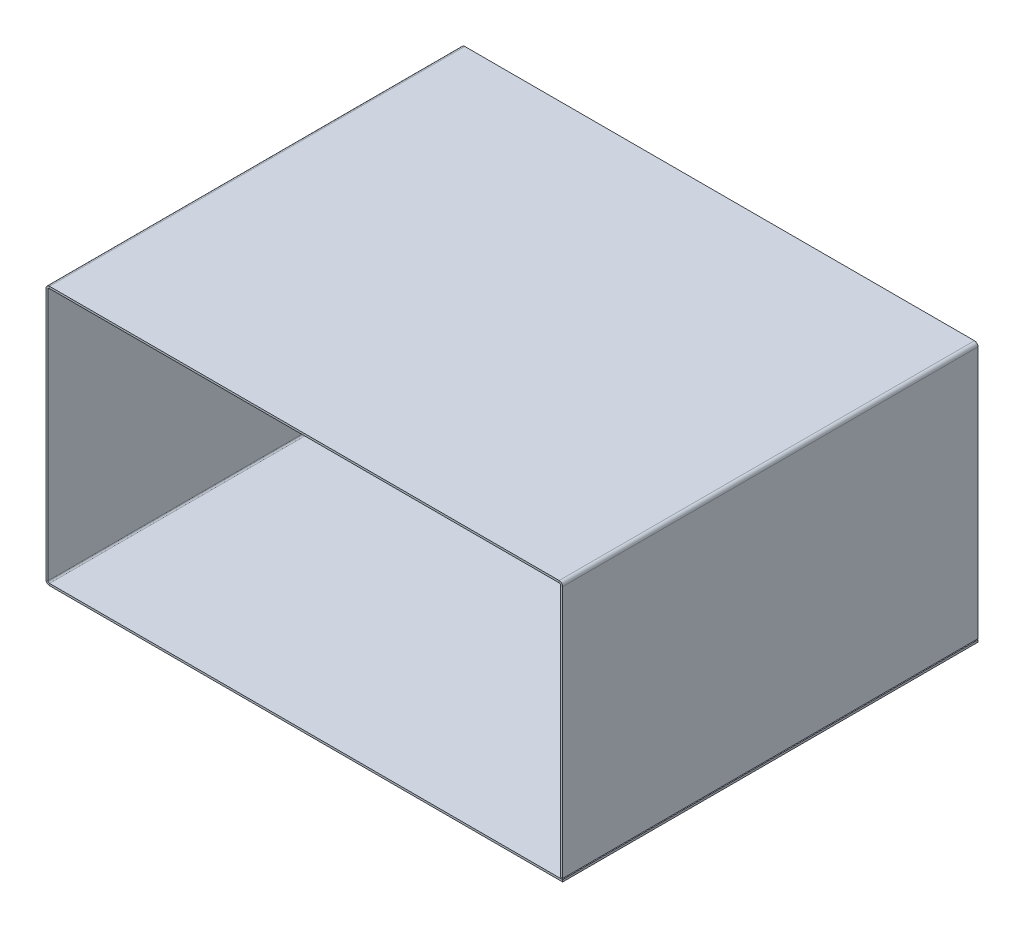
from build123d import *

# Parameters (mm, degrees)
SKETCH1_W                    = 255
SKETCH1_H                    = 205
BASE_FLANGE1_DEPTH           = 1
EDGE_FLANGE1_STRIP_W         = 5.4732
EDGE_FLANGE1_STRIP_H         = 1
EDGE_FLANGE1_STRIP_CUT_DEPTH = 205
EDGE_FLANGE1_DEPTH           = 205
EDGE_FLANGE2_STRIP_W         = 5.4732
EDGE_FLANGE2_STRIP_H         = 1
EDGE_FLANGE2_STRIP_CUT_DEPTH = 205
EDGE_FLANGE2_DEPTH           = 205
EDGE_FLANGE3_STRIP_W         = 5.4732
EDGE_FLANGE3_STRIP_H         = 1
EDGE_FLANGE3_STRIP_CUT_DEPTH = 205
EDGE_FLANGE3_DEPTH           = 205


# Sheet-metal steps are written as plain solids
with BuildPart() as part:
    # Sketch1 → Base-Flange1 (new body)
    with BuildSketch(Plane(origin=(0, 0, 0), x_dir=(1, 0, 0), z_dir=(0, 1, 0))):
        Rectangle(SKETCH1_W, SKETCH1_H)
    extrude(amount=-BASE_FLANGE1_DEPTH)

    # Edge-Flange1 strip (across the edge) → Edge-Flange1 strip cut (cut)
    with BuildSketch(Plane(origin=(-127.5, 0, -102.5), x_dir=(1, 0, 0), z_dir=(0, 0, 1))):
        with Locations((-1, -0.5)):
            Rectangle(EDGE_FLANGE1_STRIP_W, EDGE_FLANGE1_STRIP_H)
    extrude(amount=EDGE_FLANGE1_STRIP_CUT_DEPTH, mode=Mode.SUBTRACT)

    # Edge-Flange1 section (across the edge) → Edge-Flange1 (add)
    with BuildSketch(Plane(origin=(-127.5, 0, -102.5), x_dir=(1, 0, 0), z_dir=(0, 0, 1))):
        with BuildLine():
            Line((0, 0.7366), (0, 127))
            Line((0, 127), (1, 127))
            Line((1, 127), (1, 0.7366))
            ThreePointArc((1, 0.7366), (1.215745145, 0.215745145), (1.7366, 0))
            Line((1.7366, 0), (1.7366, -1))
            ThreePointArc((1.7366, -1), (0.508638364, -0.491361636), (0, 0.7366))
        make_face()
    extrude(amount=EDGE_FLANGE1_DEPTH)

    # Edge-Flange2 strip (across the edge) → Edge-Flange2 strip cut (cut)
    with BuildSketch(Plane(origin=(-126.5, 127, -102.5), x_dir=(0, -1, 0), z_dir=(0, 0, 1))):
        with Locations((-1, -0.5)):
            Rectangle(EDGE_FLANGE2_STRIP_W, EDGE_FLANGE2_STRIP_H)
    extrude(amount=EDGE_FLANGE2_STRIP_CUT_DEPTH, mode=Mode.SUBTRACT)

    # Edge-Flange2 section (across the edge) → Edge-Flange2 (add)
    with BuildSketch(Plane(origin=(-126.5, 127, -102.5), x_dir=(0, -1, 0), z_dir=(0, 0, 1))):
        with BuildLine():
            Line((0, 0.7366), (0, 254))
            Line((0, 254), (1, 254))
            Line((1, 254), (1, 0.7366))
            ThreePointArc((1, 0.7366), (1.215745145, 0.215745145), (1.7366, 0))
            Line((1.7366, 0), (1.7366, -1))
            ThreePointArc((1.7366, -1), (0.508638364, -0.491361636), (0, 0.7366))
        make_face()
    extrude(amount=EDGE_FLANGE2_DEPTH)

    # Edge-Flange3 strip (across the edge) → Edge-Flange3 strip cut (cut)
    with BuildSketch(Plane(origin=(127.5, 126, -102.5), x_dir=(-1, 0, 0), z_dir=(0, 0, 1))):
        with Locations((-1, -0.5)):
            Rectangle(EDGE_FLANGE3_STRIP_W, EDGE_FLANGE3_STRIP_H)
    extrude(amount=EDGE_FLANGE3_STRIP_CUT_DEPTH, mode=Mode.SUBTRACT)

    # Edge-Flange3 section (across the edge) → Edge-Flange3 (add)
    with BuildSketch(Plane(origin=(127.5, 126, -102.5), x_dir=(-1, 0, 0), z_dir=(0, 0, 1))):
        with BuildLine():
            Line((0, 0.7366), (0, 125.5))
            Line((0, 125.5), (1, 125.5))
            Line((1, 125.5), (1, 0.7366))
            ThreePointArc((1, 0.7366), (1.215745145, 0.215745145), (1.7366, 0))
            Line((1.7366, 0), (1.7366, -1))
            ThreePointArc((1.7366, -1), (0.508638364, -0.491361636), (0, 0.7366))
        make_face()
    extrude(amount=EDGE_FLANGE3_DEPTH)


solid = part.part
